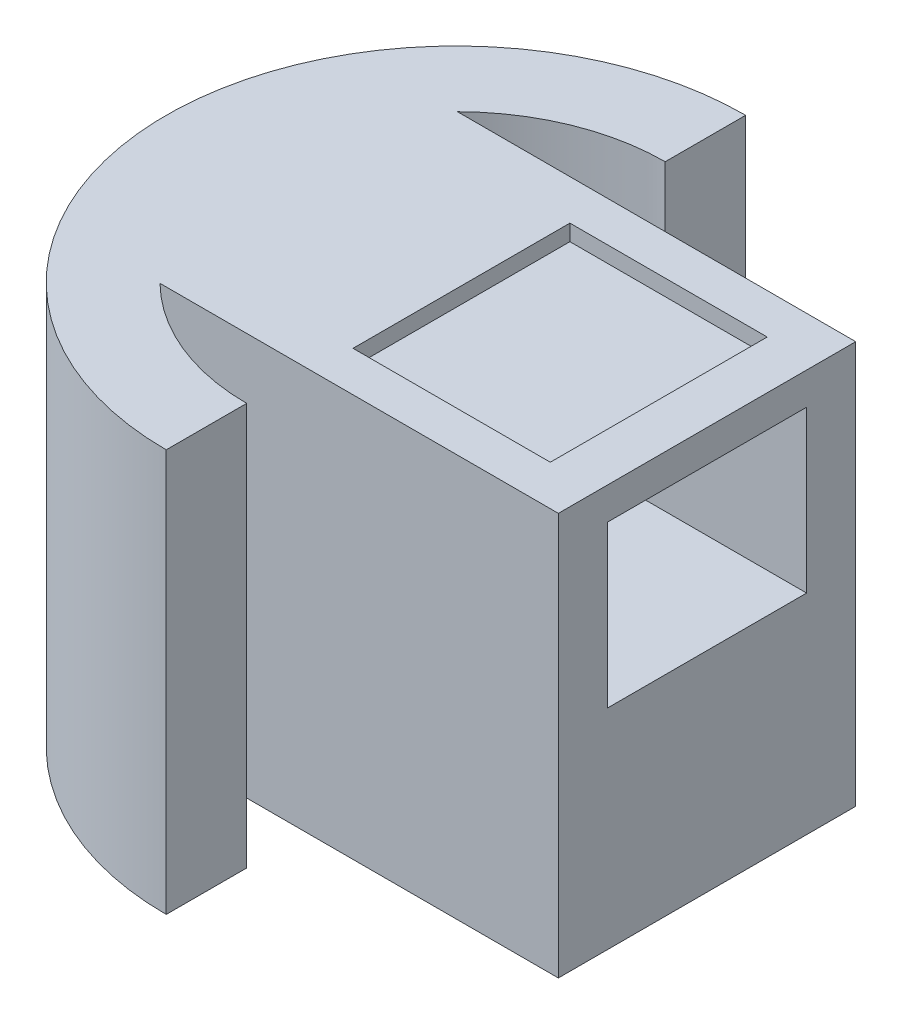
from build123d import *
from OCP.BRepAlgoAPI import BRepAlgoAPI_Cut
from OCP.TopTools import TopTools_ListOfShape

# Parameters (mm, degrees)
EXTRUDE_1_DEPTH     = 1270
SKETCH_5_W          = 72.235282366
SKETCH_5_H          = 338.817872049
EXTRUDE_1_2_DEPTH   = 1270
SKETCH_9_W          = 66.439449902
SKETCH_9_H          = 119.69450016
EXTRUDE_2_DEPTH     = 1270
SKETCH_779_W        = 1584.940783878
SKETCH_779_H        = 679.265773974
EXTRUDE_7_DEPTH     = 1270.000001702
SKETCH_15_W         = 628.465773974
SKETCH_15_H         = 508
CUT_EXTRUDE_1_DEPTH = 5080
SKETCH_16_W         = 1396.738419433
SKETCH_16_H         = 129.612550511
EXTRUDE_8_DEPTH     = 1270
SKETCH_17_W         = 1408.739581517
SKETCH_17_H         = 129.612550511
EXTRUDE_9_DEPTH     = 1270
SKETCH_20_W         = 622.659597216
SKETCH_20_H         = 684.490874996
CUT_EXTRUDE_2_DEPTH = 50.8


with BuildPart() as part:
    # 草圖1 → Extrude 1 (new body)
    with BuildSketch(Plane(origin=(0, 0, 0), x_dir=(1, 0, 0), z_dir=(0, 1, 0))):
        with BuildLine():
            ThreePointArc((0, 914.4), (-914.4, 0), (0, -914.4))
            Line((0, -914.4), (0, -660.4))
            ThreePointArc((0, -660.4), (-660.4, 0), (0, 660.4))
            Line((0, 660.4), (0, 914.4))
        make_face()
    extrude(amount=EXTRUDE_1_DEPTH)

    # 草圖5 → Extrude 1 2 (add, through all)
    with BuildSketch(Plane(origin=(0, 1270, 0), x_dir=(1, 0, 0), z_dir=(0, 1, 0))):
        with Locations((-828.280286412, 6.324353143)):
            Rectangle(SKETCH_5_W, SKETCH_5_H)
    extrude(amount=-EXTRUDE_1_2_DEPTH)

    # 草圖9 → 填補2 (add, through all)
    with BuildSketch(Plane(origin=(0, 1270, 0), x_dir=(1, 0, 0), z_dir=(0, 1, 0))):
        with Locations((-825.38237018, -198.335355397)):
            Rectangle(SKETCH_9_W, SKETCH_9_H)
    extrude(amount=-EXTRUDE_2_DEPTH)

    # Sketch 779 → 填料-伸長7 (add)
    with BuildSketch(Plane(origin=(0, 0, 0), x_dir=(1, 0, 0), z_dir=(0, 1, 0))):
        Rectangle(SKETCH_779_W, SKETCH_779_H)
    extrude(amount=EXTRUDE_7_DEPTH)

    # 草圖15 → 除料-伸長1 (cut)
    with BuildSketch(Plane(origin=(792.470391939, 0, 0), x_dir=(0, 0, -1), z_dir=(1, 0, 0))):
        with Locations((0, 914.400001702)):
            Rectangle(SKETCH_15_W, SKETCH_15_H)
    extrude(amount=-CUT_EXTRUDE_1_DEPTH, mode=Mode.SUBTRACT)

    # 草圖16 → 填料-伸長8 (add, through all)
    with BuildSketch(Plane(origin=(0, 1270, 0), x_dir=(1, 0, 0), z_dir=(0, 1, 0))):
        with Locations((94.101182222, -404.439162243)):
            Rectangle(SKETCH_16_W, SKETCH_16_H)
    extrude(amount=-EXTRUDE_8_DEPTH)

    # 草圖17 → 填料-伸長9 (add, through all)
    with BuildSketch(Plane(origin=(0, 1270, 0), x_dir=(1, 0, 0), z_dir=(0, 1, 0))):
        with Locations((88.100601181, 404.439162243)):
            Rectangle(SKETCH_17_W, SKETCH_17_H)
    extrude(amount=-EXTRUDE_9_DEPTH)


with BuildPart() as cut_extrude_2_tool:
    # 草圖20 → 除料-伸長2 (new body)
    with BuildSketch(Plane(origin=(0, 1270, 0), x_dir=(1, 0, 0), z_dir=(0, 1, 0))):
        with Locations((328.740593331, 0)):
            Rectangle(SKETCH_20_W, SKETCH_20_H)
    extrude(amount=-CUT_EXTRUDE_2_DEPTH)


with BuildPart() as part_1:
    add(part.part)

    # 除料-伸長2: cut by cut_extrude_2_tool, with a tolerance
    cut_extrude_2_stock = TopTools_ListOfShape()
    cut_extrude_2_stock.Append(part_1.part.wrapped)
    cut_extrude_2_tools = TopTools_ListOfShape()
    cut_extrude_2_tools.Append(cut_extrude_2_tool.part.wrapped)
    cut_extrude_2_cut = BRepAlgoAPI_Cut()
    cut_extrude_2_cut.SetArguments(cut_extrude_2_stock)
    cut_extrude_2_cut.SetTools(cut_extrude_2_tools)
    cut_extrude_2_cut.SetFuzzyValue(0.00001)
    cut_extrude_2_cut.Build()
    add(Compound.cast(cut_extrude_2_cut.Shape()).solids(), mode=Mode.REPLACE)


solid = part_1.part
